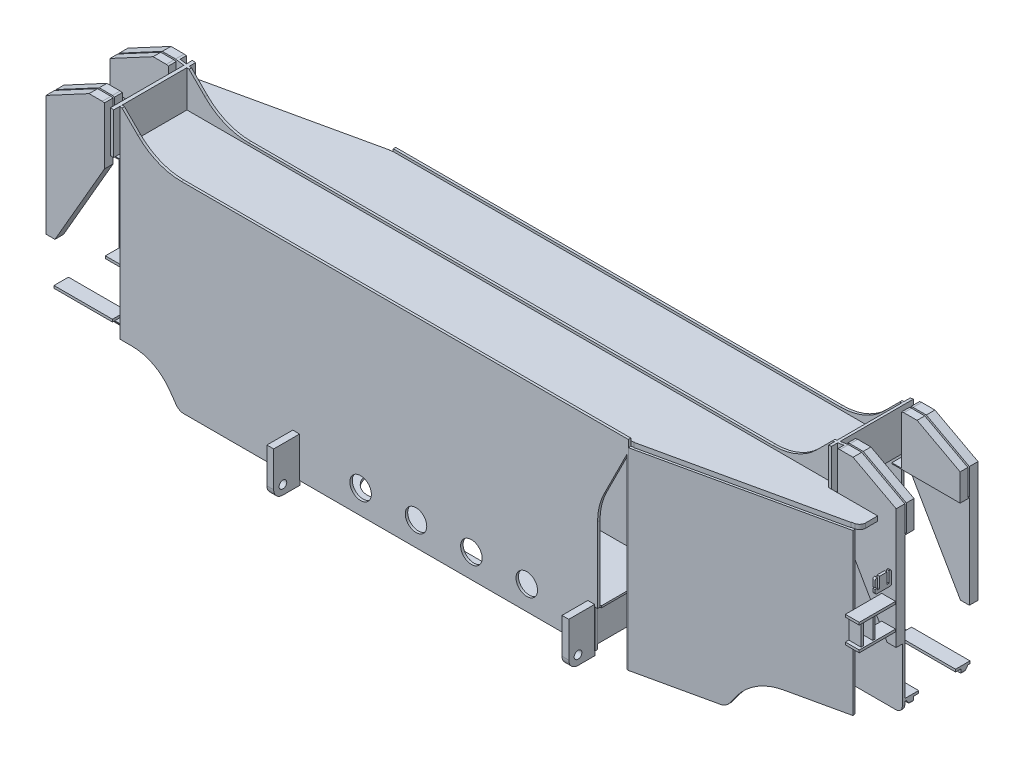
from build123d import *

# Parameters (mm, degrees)
EXTRUDE_1_DEPTH      = 8
SKETCH_4_R           = 35
SKETCH_4_R_2         = 20.25
SKETCH_4_R_3         = 10.5
CUT_EXTRUDE_2_DEPTH  = 8
EXTRUDE_2_DEPTH      = 8
SKETCH_8_R           = 35
CUT_EXTRUDE_4_DEPTH  = 8
EXTRUDE_3_DEPTH      = 8
SKETCH_12_R          = 35
CUT_EXTRUDE_6_DEPTH  = 8
EXTRUDE_4_DEPTH      = 626.98
EXTRUDE_5_DEPTH      = 626.98
EXTRUDE_6_DEPTH      = 56
EXTRUDE_7_DEPTH      = 56
EXTRUDE_8_DEPTH      = 15
EXTRUDE_9_DEPTH      = 15
SKETCH_23_W          = 1294.5
SKETCH_23_H          = 210
EXTRUDE_10_DEPTH     = 8
SKETCH_25_R          = 60
CUT_EXTRUDE_8_DEPTH  = 8
SKETCH_26_W          = 1294.5
SKETCH_26_H          = 210
EXTRUDE_11_DEPTH     = 8
SKETCH_27_R          = 60
CUT_EXTRUDE_9_DEPTH  = 8
SKETCH_29_W          = 944
SKETCH_29_H          = 210
EXTRUDE_12_DEPTH     = 6
SKETCH_30_W          = 944
SKETCH_30_H          = 210
EXTRUDE_13_DEPTH     = 6
EXTRUDE_14_DEPTH     = 20
EXTRUDE_15_DEPTH     = 20
EXTRUDE_16_DEPTH     = 20
EXTRUDE_17_DEPTH     = 20
EXTRUDE_18_DEPTH     = 8
EXTRUDE_19_DEPTH     = 8
EXTRUDE_20_DEPTH     = 25
EXTRUDE_21_DEPTH     = 25
EXTRUDE_22_DEPTH     = 25
EXTRUDE_23_DEPTH     = 25
SKETCH_50_W          = 190
SKETCH_50_H          = 3
EXTRUDE_24_DEPTH     = 30
SKETCH_51_W          = 222
SKETCH_51_H          = 3
EXTRUDE_25_DEPTH     = 32
SKETCH_53_W          = 222
SKETCH_53_H          = 3
EXTRUDE_26_DEPTH     = 32
SKETCH_54_W          = 190
SKETCH_54_H          = 3
EXTRUDE_27_DEPTH     = 30
EXTRUDE_28_DEPTH     = 346.3065
CUT_EXTRUDE_11_DEPTH = 12
EXTRUDE_29_DEPTH     = 346.3065
CUT_EXTRUDE_12_DEPTH = 12
SKETCH_62_W          = 190
SKETCH_62_H          = 47
SKETCH_62_W_2        = 617.292
EXTRUDE_30_DEPTH     = 8
SKETCH_63_W          = 617.292
SKETCH_63_H          = 47
SKETCH_63_W_2        = 190
EXTRUDE_31_DEPTH     = 8
EXTRUDE_32_DEPTH     = 319
EXTRUDE_33_DEPTH     = 319
EXTRUDE_34_DEPTH     = 319
EXTRUDE_35_DEPTH     = 319
SKETCH_71_W          = 2705
SKETCH_71_H          = 940
CUT_EXTRUDE_14_DEPTH = 600
SKETCH_73_W          = 214
SKETCH_73_H          = 109
EXTRUDE_36_DEPTH     = 22
SKETCH_75_R          = 12.5
CUT_EXTRUDE_16_DEPTH = 22
SKETCH_77_W          = 214
SKETCH_77_H          = 109
EXTRUDE_37_DEPTH     = 22
SKETCH_79_R          = 12.5
CUT_EXTRUDE_18_DEPTH = 22
SKETCH_81_W          = 118
SKETCH_81_H          = 8
EXTRUDE_38_DEPTH     = 45
SKETCH_83_W          = 8
SKETCH_83_H          = 70
EXTRUDE_39_DEPTH     = 40
SKETCH_85_W          = 118
SKETCH_85_H          = 8
EXTRUDE_40_DEPTH     = 45
SKETCH_86_W          = 8
SKETCH_86_H          = 70
EXTRUDE_41_DEPTH     = 40
EXTRUDE_42_DEPTH     = 8
SKETCH_90_W          = 7
SKETCH_90_H          = 42
CUT_EXTRUDE_20_DEPTH = 8
SKETCH_91_R          = 2.5
CUT_EXTRUDE_21_DEPTH = 8
EXTRUDE_43_DEPTH     = 8
SKETCH_95_W          = 7
SKETCH_95_H          = 42
CUT_EXTRUDE_23_DEPTH = 8
SKETCH_96_R          = 2.5
CUT_EXTRUDE_24_DEPTH = 8
EXTRUDE_44_DEPTH     = 266
EXTRUDE_45_DEPTH     = 266
EXTRUDE_46_DEPTH     = 188
EXTRUDE_47_DEPTH     = 188


with BuildPart() as part:
    # ｽｹｯﾁ2 → ﾎﾞｽ - 押し出し1 (new body)
    with BuildSketch(Plane.XY.offset(238)):
        with BuildLine():
            Line((20, 120), (259.781, 119.999840908))
            ThreePointArc((259.781, 119.999840908), (329.136433358, 103.002917773), (382.774130448, 55.864091069))
            Line((382.774130448, 55.864091069), (403.045155312, 26.827108426))
            ThreePointArc((403.045155312, 26.827108426), (413.772782228, 17.399235302), (427.644, 13.999810585))
            Line((427.644, 13.999810585), (2117.356, 13.999810585))
            ThreePointArc((2117.356, 13.999810585), (2131.227217772, 17.399235302), (2141.954844688, 26.827108426))
            Line((2141.954844688, 26.827108426), (2162.225869552, 55.864091069))
            ThreePointArc((2162.225869552, 55.864091069), (2215.863566642, 103.002917773), (2285.219, 119.999840908))
            Line((2285.219, 119.999840908), (2525, 120))
            ThreePointArc((2525, 120), (2539.142135624, 125.857864376), (2545, 140))
            Line((2545, 140), (2545, 315.36))
            Line((2545, 315.36), (2545, 706))
            Line((2545, 706), (2405, 781))
            Line((2405, 781), (2362, 781))
            Line((2362, 781), (2318, 774))
            Line((2318, 774), (2266.578928118, 722.579071882))
            ThreePointArc((2266.578928118, 722.579071882), (2201.694052016, 679.224134879), (2125.157, 663.999898344))
            Line((2125.157, 663.999898344), (419.843, 663.999898344))
            ThreePointArc((419.843, 663.999898344), (343.305947984, 679.224134879), (278.421071882, 722.579071882))
            Line((278.421071882, 722.579071882), (227, 774))
            Line((227, 774), (183, 781))
            Line((183, 781), (140, 781))
            Line((140, 781), (0, 706))
            Line((0, 706), (0, 315.36))
            Line((0, 315.36), (0, 140))
            ThreePointArc((0, 140), (5.857864376, 125.857864376), (20, 120))
        make_face()
    extrude(amount=EXTRUDE_1_DEPTH)

    # ｽｹｯﾁ4 → ｶｯﾄ - 押し出し2 (cut)
    with BuildSketch(Plane.XY.offset(238)):
        with Locations((972.5, 92)):
            Circle(SKETCH_4_R)
        with Locations((1272.5, 92)):
            Circle(SKETCH_4_R)
        with Locations((1572.5, 92)):
            Circle(SKETCH_4_R)
        with Locations((50, 499)):
            Circle(SKETCH_4_R_2)
        with Locations((2495, 499)):
            Circle(SKETCH_4_R_2)
        with Locations((27, 401.5)):
            Circle(SKETCH_4_R_3)
        with Locations((2518, 401.5)):
            Circle(SKETCH_4_R_3)
        with BuildLine():
            Line((1072.5, 297), (1472.5, 297))
            ThreePointArc((1472.5, 297), (1543.210678119, 326.289321881), (1572.5, 397))
            ThreePointArc((1572.5, 397), (1543.210678119, 467.710678119), (1472.5, 497))
            Line((1472.5, 497), (1072.5, 497))
            ThreePointArc((1072.5, 497), (1001.789321881, 467.710678119), (972.5, 397))
            ThreePointArc((972.5, 397), (1001.789321881, 326.289321881), (1072.5, 297))
        make_face()
    extrude(amount=CUT_EXTRUDE_2_DEPTH, mode=Mode.SUBTRACT)



with BuildPart() as body_2:
    # ｽｹｯﾁ6 → ﾎﾞｽ - 押し出し2 (new body)
    with BuildSketch(Plane.XY.offset(20)):
        with BuildLine():
            Line((781, 14), (2117.356, 13.999810585))
            ThreePointArc((2117.356, 13.999810585), (2131.227217772, 17.399235302), (2141.954844688, 26.827108426))
            Line((2141.954844688, 26.827108426), (2162.225869552, 55.864091069))
            ThreePointArc((2162.225869552, 55.864091069), (2215.863566642, 103.002917773), (2285.219, 119.999840908))
            Line((2285.219, 119.999840908), (2325, 120))
            Line((2325, 120), (2325, 775.113636364))
            Line((2325, 775.113636364), (2318, 774))
            Line((2318, 774), (2266.578928118, 722.579071882))
            ThreePointArc((2266.578928118, 722.579071882), (2201.694052016, 679.224134879), (2125.157, 663.999898344))
            Line((2125.157, 663.999898344), (672.5, 664))
            Line((672.5, 664), (672.5, 629))
            Line((672.5, 629), (751.3851191, 471.22905955))
            ThreePointArc((751.3851191, 471.22905955), (767.149616924, 427.736771141), (772.499866842, 381.786))
            Line((772.499866842, 381.786), (772.5, 138))
            Line((772.5, 138), (781, 138))
            Line((781, 138), (781, 14))
        make_face()
    extrude(amount=EXTRUDE_2_DEPTH)

    # ｽｹｯﾁ8 → ｶｯﾄ - 押し出し4 (cut)
    with BuildSketch(Plane.XY.offset(20)):
        with Locations((1002.5, 92)):
            Circle(SKETCH_8_R)
        with Locations((1182.5, 92)):
            Circle(SKETCH_8_R)
        with Locations((1362.5, 92)):
            Circle(SKETCH_8_R)
        with Locations((1542.5, 92)):
            Circle(SKETCH_8_R)
    extrude(amount=CUT_EXTRUDE_4_DEPTH, mode=Mode.SUBTRACT)

    # ｽｹｯﾁ14 → ﾎﾞｽ - 押し出し4 (add)
    with BuildSketch(Plane(origin=(0, 14, 0), x_dir=(1, 0, 0), z_dir=(0, 1, 0))):
        Polygon((678.359363657, -26.708544411), (75.7, -159.54), (73.978059215, -151.727515124), (671.628819639, -20), (676.880741117, -20), align=None)
    extrude(amount=EXTRUDE_4_DEPTH)

    # ｽｹｯﾁ17 → ﾎﾞｽ - 押し出し6 (add)
    with BuildSketch(Plane(origin=(0, 600, 0), x_dir=(1, 0, 0), z_dir=(0, 1, 0))):
        Polygon((662.519151307, -29.175865372), (85.250363496, -156.411013409), (85.680848693, -158.364134628), (662.949636504, -31.128986591), align=None)
    extrude(amount=EXTRUDE_6_DEPTH)


with BuildPart() as body_3:
    # ｽｹｯﾁ10 → ﾎﾞｽ - 押し出し3 (new body)
    with BuildSketch(Plane.XY.offset(456)):
        with BuildLine():
            Line((1764, 14), (1764, 138))
            Line((1764, 138), (1772.5, 138))
            Line((1772.5, 138), (1772.500133158, 381.786))
            ThreePointArc((1772.500133158, 381.786), (1777.850383076, 427.736771141), (1793.6148809, 471.22905955))
            Line((1793.6148809, 471.22905955), (1872.5, 629))
            Line((1872.5, 629), (1872.5, 664))
            Line((1872.5, 664), (419.843, 663.999898344))
            ThreePointArc((419.843, 663.999898344), (343.305947984, 679.224134879), (278.421071882, 722.579071882))
            Line((278.421071882, 722.579071882), (227, 774))
            Line((227, 774), (220, 775.113636364))
            Line((220, 775.113636364), (220, 120))
            Line((220, 120), (259.781, 119.999840908))
            ThreePointArc((259.781, 119.999840908), (329.136433358, 103.002917773), (382.774130448, 55.864091069))
            Line((382.774130448, 55.864091069), (403.045155312, 26.827108426))
            ThreePointArc((403.045155312, 26.827108426), (413.772782228, 17.399235302), (427.644, 13.999810585))
            Line((427.644, 13.999810585), (1764, 14))
        make_face()
    extrude(amount=EXTRUDE_3_DEPTH)

    # ｽｹｯﾁ12 → ｶｯﾄ - 押し出し6 (cut)
    with BuildSketch(Plane.XY.offset(456)):
        with Locations((1002.5, 92)):
            Circle(SKETCH_12_R)
        with Locations((1182.5, 92)):
            Circle(SKETCH_12_R)
        with Locations((1362.5, 92)):
            Circle(SKETCH_12_R)
        with Locations((1542.5, 92)):
            Circle(SKETCH_12_R)
    extrude(amount=CUT_EXTRUDE_6_DEPTH, mode=Mode.SUBTRACT)

    # ｽｹｯﾁ15 → ﾎﾞｽ - 押し出し5 (add)
    with BuildSketch(Plane(origin=(0, 14, 0), x_dir=(1, 0, 0), z_dir=(0, 1, 0))):
        Polygon((1866.640636343, -457.291455589), (2469.3, -324.46), (2471.021940785, -332.272484876), (1873.371180361, -464), (1868.119258883, -464), align=None)
    extrude(amount=EXTRUDE_5_DEPTH)

    # ｽｹｯﾁ18 → ﾎﾞｽ - 押し出し7 (add)
    with BuildSketch(Plane(origin=(0, 600, 0), x_dir=(1, 0, 0), z_dir=(0, 1, 0))):
        Polygon((1882.480848693, -454.824134628), (2459.749636504, -327.588986591), (2459.319151307, -325.635865372), (1882.050363496, -452.871013409), align=None)
    extrude(amount=EXTRUDE_7_DEPTH)


with BuildPart() as part_1:
    add(part.part)

    add(body_2.part)  # ﾎﾞｽ - 押し出し8 merges body 2
    # ｽｹｯﾁ20 → ﾎﾞｽ - 押し出し8 (add)
    with BuildSketch(Plane(origin=(0, 641, 0), x_dir=(1, 0, 0), z_dir=(0, 1, 0))):
        with BuildLine():
            Line((672.5, -28), (75.720556621, -159.532541471))
            ThreePointArc((75.720556621, -159.532541471), (64.416289327, -166.53198258), (59.997398288, -179.072))
            Line((59.997398288, -179.072), (60, -218))
            Line((60, -218), (220, -218))
            Line((220, -218), (220, -238))
            Line((220, -238), (2324.98, -238))
            Line((2324.98, -238), (2324.98, -28))
            Line((2324.98, -28), (672.5, -28))
        make_face()
    extrude(amount=EXTRUDE_8_DEPTH)


    add(body_3.part)  # ﾎﾞｽ - 押し出し9 merges body 3
    # ｽｹｯﾁ21 → ﾎﾞｽ - 押し出し9 (add)
    with BuildSketch(Plane(origin=(0, 641, 0), x_dir=(1, 0, 0), z_dir=(0, 1, 0))):
        with BuildLine():
            Line((1872.5, -456), (2469.279443379, -324.467458529))
            ThreePointArc((2469.279443379, -324.467458529), (2480.583710673, -317.46801742), (2485.002601712, -304.928))
            Line((2485.002601712, -304.928), (2485, -266))
            Line((2485, -266), (2325, -266))
            Line((2325, -266), (2325, -246))
            Line((2325, -246), (220.02, -246))
            Line((220.02, -246), (220.02, -456))
            Line((220.02, -456), (1872.5, -456))
        make_face()
    extrude(amount=EXTRUDE_9_DEPTH)

    # ｽｹｯﾁ23 → ﾎﾞｽ - 押し出し10 (add)
    with BuildSketch(Plane(origin=(0, 22, 0), x_dir=(1, 0, 0), z_dir=(0, 1, 0))):
        with Locations((1451.25, -133)):
            Rectangle(SKETCH_23_W, SKETCH_23_H)
    extrude(amount=EXTRUDE_10_DEPTH)

    # ｽｹｯﾁ25 → ｶｯﾄ - 押し出し8 (cut)
    with BuildSketch(Plane(origin=(0, 22, 0), x_dir=(1, 0, 0), z_dir=(0, 1, 0))):
        with Locations((972, -133)):
            Circle(SKETCH_25_R)
        with Locations((1572, -133)):
            Circle(SKETCH_25_R)
        with Locations((1942, -133)):
            Circle(SKETCH_25_R)
        with BuildLine():
            Line((1202, -73), (1342, -73))
            ThreePointArc((1342, -73), (1384.426406871, -90.573593129), (1402, -133))
            ThreePointArc((1402, -133), (1384.426406871, -175.426406871), (1342, -193))
            Line((1342, -193), (1202, -193))
            ThreePointArc((1202, -193), (1159.573593129, -175.426406871), (1142, -133))
            ThreePointArc((1142, -133), (1159.573593129, -90.573593129), (1202, -73))
        make_face()
    extrude(amount=CUT_EXTRUDE_8_DEPTH, mode=Mode.SUBTRACT)

    # ｽｹｯﾁ26 → ﾎﾞｽ - 押し出し11 (add)
    with BuildSketch(Plane(origin=(0, 22, 0), x_dir=(1, 0, 0), z_dir=(0, 1, 0))):
        with Locations((1093.75, -351)):
            Rectangle(SKETCH_26_W, SKETCH_26_H)
    extrude(amount=EXTRUDE_11_DEPTH)

    # ｽｹｯﾁ27 → ｶｯﾄ - 押し出し9 (cut)
    with BuildSketch(Plane(origin=(0, 22, 0), x_dir=(1, 0, 0), z_dir=(0, 1, 0))):
        with Locations((603, -351)):
            Circle(SKETCH_27_R)
        with Locations((973, -351)):
            Circle(SKETCH_27_R)
        with Locations((1573, -351)):
            Circle(SKETCH_27_R)
        with BuildLine():
            Line((1203, -291), (1343, -291))
            ThreePointArc((1343, -291), (1385.426406871, -308.573593129), (1403, -351))
            ThreePointArc((1403, -351), (1385.426406871, -393.426406871), (1343, -411))
            Line((1343, -411), (1203, -411))
            ThreePointArc((1203, -411), (1160.573593129, -393.426406871), (1143, -351))
            ThreePointArc((1143, -351), (1160.573593129, -308.573593129), (1203, -291))
        make_face()
    extrude(amount=CUT_EXTRUDE_9_DEPTH, mode=Mode.SUBTRACT)

    # ｽｹｯﾁ29 → ﾎﾞｽ - 押し出し12 (add)
    with BuildSketch(Plane(origin=(0, 138, 0), x_dir=(1, 0, 0), z_dir=(0, 1, 0))):
        with Locations((1240, -133)):
            Rectangle(SKETCH_29_W, SKETCH_29_H)
    extrude(amount=EXTRUDE_12_DEPTH)

    # ｽｹｯﾁ30 → ﾎﾞｽ - 押し出し13 (add)
    with BuildSketch(Plane(origin=(0, 138, 0), x_dir=(1, 0, 0), z_dir=(0, 1, 0))):
        with Locations((1305, -351)):
            Rectangle(SKETCH_30_W, SKETCH_30_H)
    extrude(amount=EXTRUDE_13_DEPTH)

    # ｽｹｯﾁ32 → ﾎﾞｽ - 押し出し14 (add)
    with BuildSketch(Plane.XY.offset(218)):
        Polygon((0, 315.36), (29.105181683, 315.36), (190, 594.038), (190, 779.886363636), (183, 781), (140, 781), (0, 706), align=None)
    extrude(amount=EXTRUDE_14_DEPTH)

    # ｽｹｯﾁ37 → ﾎﾞｽ - 押し出し17 (add)
    with BuildSketch(Plane.XY.offset(246)):
        Polygon((2545, 315.36), (2545, 706), (2405, 781), (2362, 781), (2355, 779.886363636), (2355, 594.038), (2515.894818317, 315.36), align=None)
    extrude(amount=EXTRUDE_17_DEPTH)



with BuildPart() as body_2_2:
    # ｽｹｯﾁ34 → ﾎﾞｽ - 押し出し15 (new body)
    with BuildSketch(Plane.XY.offset(464)):
        Polygon((0, 315.36), (29.105181683, 315.36), (190, 594.038), (190, 779.886363636), (183, 781), (140, 781), (0, 706), align=None)
    extrude(amount=EXTRUDE_15_DEPTH)

    # ｽｹｯﾁ41 → ﾎﾞｽ - 押し出し19 (add)
    with BuildSketch(Plane.XY.offset(456)):
        Polygon((0, 315.36), (29.105181683, 315.36), (190, 594.038), (190, 779.886363636), (183, 781), (140, 781), (0, 706), align=None)
    extrude(amount=EXTRUDE_19_DEPTH)


with BuildPart() as body_3_2:
    # ｽｹｯﾁ35 → ﾎﾞｽ - 押し出し16 (new body)
    with BuildSketch(Plane.XY):
        Polygon((2545, 315.36), (2545, 706), (2405, 781), (2362, 781), (2355, 779.886363636), (2355, 594.038), (2515.894818317, 315.36), align=None)
    extrude(amount=EXTRUDE_16_DEPTH)

    # ｽｹｯﾁ39 → ﾎﾞｽ - 押し出し18 (add)
    with BuildSketch(Plane.XY.offset(20)):
        Polygon((2545, 315.36), (2545, 706), (2405, 781), (2362, 781), (2355, 779.886363636), (2355, 594.038), (2515.894818317, 315.36), align=None)
    extrude(amount=EXTRUDE_18_DEPTH)


with BuildPart() as body_4:
    # ｽｹｯﾁ43 → ﾎﾞｽ - 押し出し20 (new body)
    with BuildSketch(Plane.XY.offset(251)):
        Polygon((0, 620.82), (190, 620.82), (190, 779.886363636), (183, 781), (140, 781), (0, 706), align=None)
    extrude(amount=EXTRUDE_20_DEPTH)


with BuildPart() as body_5:
    # ｽｹｯﾁ45 → ﾎﾞｽ - 押し出し21 (new body)
    with BuildSketch(Plane.XY.offset(426)):
        Polygon((0, 620.82), (190, 620.82), (190, 779.886363636), (183, 781), (140, 781), (0, 706), align=None)
    extrude(amount=EXTRUDE_21_DEPTH)


with BuildPart() as body_6:
    # ｽｹｯﾁ47 → ﾎﾞｽ - 押し出し22 (new body)
    with BuildSketch(Plane.XY.offset(33)):
        Polygon((2545, 620.82), (2545, 706), (2405, 781), (2362, 781), (2355, 779.886363636), (2355, 620.82), align=None)
    extrude(amount=EXTRUDE_22_DEPTH)


with BuildPart() as body_7:
    # ｽｹｯﾁ49 → ﾎﾞｽ - 押し出し23 (new body)
    with BuildSketch(Plane.XY.offset(208)):
        Polygon((2545, 620.82), (2545, 706), (2405, 781), (2362, 781), (2355, 779.886363636), (2355, 620.82), align=None)
    extrude(amount=EXTRUDE_23_DEPTH)


with BuildPart() as part_2:
    add(part_1.part)

    add(body_4.part)  # ﾎﾞｽ - 押し出し24 merges body 4
    # ｽｹｯﾁ50 → ﾎﾞｽ - 押し出し24 (add)
    with BuildSketch(Plane.XY.offset(246)):
        with Locations((95, 619.32)):
            Rectangle(SKETCH_50_W, SKETCH_50_H)
    extrude(amount=EXTRUDE_24_DEPTH)


    add(body_2_2.part)  # ﾎﾞｽ - 押し出し25 merges body 2 2

    add(body_5.part)  # ﾎﾞｽ - 押し出し25 merges body 5
    # ｽｹｯﾁ51 → ﾎﾞｽ - 押し出し25 (add)
    with BuildSketch(Plane.XY.offset(426)):
        with Locations((111, 619.32)):
            Rectangle(SKETCH_51_W, SKETCH_51_H)
    extrude(amount=EXTRUDE_25_DEPTH)


    add(body_3_2.part)  # ﾎﾞｽ - 押し出し26 merges body 3 2

    add(body_6.part)  # ﾎﾞｽ - 押し出し26 merges body 6
    # ｽｹｯﾁ53 → ﾎﾞｽ - 押し出し26 (add)
    with BuildSketch(Plane.XY.offset(26)):
        with Locations((2434, 619.32)):
            Rectangle(SKETCH_53_W, SKETCH_53_H)
    extrude(amount=EXTRUDE_26_DEPTH)


    add(body_7.part)  # ﾎﾞｽ - 押し出し27 merges body 7
    # ｽｹｯﾁ54 → ﾎﾞｽ - 押し出し27 (add)
    with BuildSketch(Plane.XY.offset(208)):
        with Locations((2450, 619.32)):
            Rectangle(SKETCH_54_W, SKETCH_54_H)
    extrude(amount=EXTRUDE_27_DEPTH)



with BuildPart() as body_2_3:
    # ｽｹｯﾁ55 → ﾎﾞｽ - 押し出し28 (new body)
    with BuildSketch(Plane(origin=(0, 0, 0), x_dir=(0, 0, -1), z_dir=(1, 0, 0))):
        Polygon((-251.6, 150), (-450.4, 150), (-450.4, 149), (-442.698, 138), (-259.302, 138), (-251.6, 149), align=None)
    extrude(amount=EXTRUDE_28_DEPTH)

    # ｽｹｯﾁ57 → ｶｯﾄ - 押し出し11 (cut)
    with BuildSketch(Plane(origin=(0, 138, 0), x_dir=(1, 0, 0), z_dir=(0, 1, 0))):
        with BuildLine():
            Line((-10, -273.771), (155, -273.771))
            ThreePointArc((155, -273.771), (183.284271247, -285.486728753), (195, -313.771))
            Line((195, -313.771), (195, -388.229))
            ThreePointArc((195, -388.229), (183.284271247, -416.513271247), (155, -428.229))
            Line((155, -428.229), (-10, -428.229))
            Line((-10, -428.229), (-10, -273.771))
        make_face()
    extrude(amount=CUT_EXTRUDE_11_DEPTH, mode=Mode.SUBTRACT)


with BuildPart() as body_3_3:
    # ｽｹｯﾁ59 → ﾎﾞｽ - 押し出し29 (new body)
    with BuildSketch(Plane(origin=(2545, 0, 0), x_dir=(0, 0, -1), z_dir=(1, 0, 0))):
        Polygon((-232.4, 150), (-232.4, 149), (-224.698, 138), (-41.302, 138), (-33.6, 149), (-33.6, 150), align=None)
    extrude(amount=-EXTRUDE_29_DEPTH)

    # ｽｹｯﾁ60 → ｶｯﾄ - 押し出し12 (cut)
    with BuildSketch(Plane(origin=(0, 138, 0), x_dir=(1, 0, 0), z_dir=(0, 1, 0))):
        with BuildLine():
            Line((2555, -210.229), (2390, -210.229))
            ThreePointArc((2390, -210.229), (2361.715728753, -198.513271247), (2350, -170.229))
            Line((2350, -170.229), (2350, -95.771))
            ThreePointArc((2350, -95.771), (2361.715728753, -67.486728753), (2390, -55.771))
            Line((2390, -55.771), (2555, -55.771))
            Line((2555, -55.771), (2555, -210.229))
        make_face()
    extrude(amount=CUT_EXTRUDE_12_DEPTH, mode=Mode.SUBTRACT)


with BuildPart() as part_3:
    add(part_2.part)

    add(body_2_3.part)  # ﾎﾞｽ - 押し出し30 merges body 2 3
    # ｽｹｯﾁ62 → ﾎﾞｽ - 押し出し30 (add)
    with BuildSketch(Plane(origin=(0, 150, 0), x_dir=(1, 0, 0), z_dir=(0, 1, 0))):
        with Locations((95, -267.5)):
            Rectangle(SKETCH_62_W, SKETCH_62_H)
        with Locations((95, -434.5)):
            Rectangle(SKETCH_62_W, SKETCH_62_H)
        with Locations((524.354, -267.5)):
            Rectangle(SKETCH_62_W_2, SKETCH_62_H)
        with Locations((524.354, -434.5)):
            Rectangle(SKETCH_62_W_2, SKETCH_62_H)
    extrude(amount=EXTRUDE_30_DEPTH)


    add(body_3_3.part)  # ﾎﾞｽ - 押し出し31 merges body 3 3
    # ｽｹｯﾁ63 → ﾎﾞｽ - 押し出し31 (add)
    with BuildSketch(Plane(origin=(0, 150, 0), x_dir=(1, 0, 0), z_dir=(0, 1, 0))):
        with Locations((2020.646, -216.5)):
            Rectangle(SKETCH_63_W, SKETCH_63_H)
        with Locations((2020.646, -49.5)):
            Rectangle(SKETCH_63_W, SKETCH_63_H)
        with Locations((2450, -216.5)):
            Rectangle(SKETCH_63_W_2, SKETCH_63_H)
        with Locations((2450, -49.5)):
            Rectangle(SKETCH_63_W_2, SKETCH_63_H)
    extrude(amount=EXTRUDE_31_DEPTH)

    # ｽｹｯﾁ65 → ﾎﾞｽ - 押し出し32 (add)
    with BuildSketch(Plane(origin=(1771.5, 0, 0), x_dir=(0, 0, -1), z_dir=(1, 0, 0))):
        Polygon((-28, 30), (-40.32, 29.97), (-63.75, 129.12), (-53.54, 138), align=None)
    extrude(amount=EXTRUDE_32_DEPTH)

    # ｽｹｯﾁ66 → ﾎﾞｽ - 押し出し33 (add)
    with BuildSketch(Plane(origin=(1771.5, 0, 0), x_dir=(0, 0, -1), z_dir=(1, 0, 0))):
        Polygon((-212.46, 138), (-202.25, 129.12), (-225.68, 29.97), (-238, 30), align=None)
    extrude(amount=EXTRUDE_33_DEPTH)

    # ｽｹｯﾁ68 → ﾎﾞｽ - 押し出し34 (add)
    with BuildSketch(Plane(origin=(454.5, 0, 0), x_dir=(0, 0, -1), z_dir=(1, 0, 0))):
        Polygon((-430.46, 138), (-420.25, 129.12), (-443.68, 29.97), (-456, 30), align=None)
    extrude(amount=EXTRUDE_34_DEPTH)

    # ｽｹｯﾁ69 → ﾎﾞｽ - 押し出し35 (add)
    with BuildSketch(Plane(origin=(454.5, 0, 0), x_dir=(0, 0, -1), z_dir=(1, 0, 0))):
        Polygon((-246, 30), (-258.32, 29.97), (-281.75, 129.12), (-271.54, 138), align=None)
    extrude(amount=EXTRUDE_35_DEPTH)

    # ｽｹｯﾁ71 → ｶｯﾄ - 押し出し14 (cut)
    with BuildSketch(Plane.XY):
        with Locations((1272.5, 390)):
            Rectangle(SKETCH_71_W, SKETCH_71_H)
        with BuildLine():
            Line((20, 120), (259.781, 119.999840908))
            ThreePointArc((259.781, 119.999840908), (329.136433358, 103.002917773), (382.774130448, 55.864091069))
            Line((382.774130448, 55.864091069), (403.045155312, 26.827108426))
            ThreePointArc((403.045155312, 26.827108426), (413.772782228, 17.399235302), (427.644, 13.999810585))
            Line((427.644, 13.999810585), (2117.356, 13.999810585))
            ThreePointArc((2117.356, 13.999810585), (2131.227217772, 17.399235302), (2141.954844688, 26.827108426))
            Line((2141.954844688, 26.827108426), (2162.225869552, 55.864091069))
            ThreePointArc((2162.225869552, 55.864091069), (2215.863566642, 103.002917773), (2285.219, 119.999840908))
            Line((2285.219, 119.999840908), (2525, 120))
            ThreePointArc((2525, 120), (2539.142135624, 125.857864376), (2545, 140))
            Line((2545, 140), (2545, 315.36))
            Line((2545, 315.36), (2545, 706))
            Line((2545, 706), (2405, 781))
            Line((2405, 781), (2362, 781))
            Line((2362, 781), (2318, 774))
            Line((2318, 774), (2266.578928118, 722.579071882))
            ThreePointArc((2266.578928118, 722.579071882), (2201.694052016, 679.224134879), (2125.157, 663.999898344))
            Line((2125.157, 663.999898344), (419.843, 663.999898344))
            ThreePointArc((419.843, 663.999898344), (343.305947984, 679.224134879), (278.421071882, 722.579071882))
            Line((278.421071882, 722.579071882), (227, 774))
            Line((227, 774), (183, 781))
            Line((183, 781), (140, 781))
            Line((140, 781), (0, 706))
            Line((0, 706), (0, 315.36))
            Line((0, 315.36), (0, 140))
            ThreePointArc((0, 140), (5.857864376, 125.857864376), (20, 120))
        make_face(mode=Mode.SUBTRACT)
    extrude(amount=CUT_EXTRUDE_14_DEPTH, mode=Mode.SUBTRACT)

    # ｽｹｯﾁ73 → ﾎﾞｽ - 押し出し36 (add)
    with BuildSketch(Plane(origin=(782, 0, 0), x_dir=(0, 0, -1), z_dir=(1, 0, 0))):
        with Locations((-133, 83.5)):
            Rectangle(SKETCH_73_W, SKETCH_73_H)
        with Locations((-351, 83.5)):
            Rectangle(SKETCH_73_W, SKETCH_73_H)
        with BuildLine():
            Line((-462, 0), (-518, 0))
            ThreePointArc((-518, 0), (-539.213203436, 8.786796564), (-548, 30))
            Line((-548, 30), (-548, 145))
            Line((-548, 145), (-462, 145))
            Line((-462, 145), (-462, 0))
        make_face()
    extrude(amount=EXTRUDE_36_DEPTH)

    # ｽｹｯﾁ75 → ｶｯﾄ - 押し出し16 (cut)
    with BuildSketch(Plane(origin=(782, 0, 0), x_dir=(0, 0, -1), z_dir=(1, 0, 0))):
        with Locations((-518, 30)):
            Circle(SKETCH_75_R)
    extrude(amount=CUT_EXTRUDE_16_DEPTH, mode=Mode.SUBTRACT)

    # ｽｹｯﾁ77 → ﾎﾞｽ - 押し出し37 (add)
    with BuildSketch(Plane(origin=(1741, 0, 0), x_dir=(0, 0, -1), z_dir=(1, 0, 0))):
        with Locations((-133, 83.5)):
            Rectangle(SKETCH_77_W, SKETCH_77_H)
        with Locations((-351, 83.5)):
            Rectangle(SKETCH_77_W, SKETCH_77_H)
        with BuildLine():
            Line((-462, 0), (-518, 0))
            ThreePointArc((-518, 0), (-539.213203436, 8.786796564), (-548, 30))
            Line((-548, 30), (-548, 145))
            Line((-548, 145), (-462, 145))
            Line((-462, 145), (-462, 0))
        make_face()
    extrude(amount=EXTRUDE_37_DEPTH)

    # ｽｹｯﾁ79 → ｶｯﾄ - 押し出し18 (cut)
    with BuildSketch(Plane(origin=(1741, 0, 0), x_dir=(0, 0, -1), z_dir=(1, 0, 0))):
        with Locations((-518, 30)):
            Circle(SKETCH_79_R)
    extrude(amount=CUT_EXTRUDE_18_DEPTH, mode=Mode.SUBTRACT)

    # ｽｹｯﾁ81 → ﾎﾞｽ - 押し出し38 (add)
    with BuildSketch(Plane(origin=(2, 0, 0), x_dir=(0, 0, -1), z_dir=(1, 0, 0))):
        with Locations((-159, 362.5)):
            Rectangle(SKETCH_81_W, SKETCH_81_H)
        with Locations((-159, 440.5)):
            Rectangle(SKETCH_81_W, SKETCH_81_H)
    extrude(amount=EXTRUDE_38_DEPTH)

    # ｽｹｯﾁ83 → ﾎﾞｽ - 押し出し39 (add)
    with BuildSketch(Plane(origin=(7, 0, 0), x_dir=(0, 0, -1), z_dir=(1, 0, 0))):
        with Locations((-115, 401.5)):
            Rectangle(SKETCH_83_W, SKETCH_83_H)
        with Locations((-153, 401.5)):
            Rectangle(SKETCH_83_W, SKETCH_83_H)
    extrude(amount=EXTRUDE_39_DEPTH)

    # ｽｹｯﾁ85 → ﾎﾞｽ - 押し出し40 (add)
    with BuildSketch(Plane(origin=(2498, 0, 0), x_dir=(0, 0, -1), z_dir=(1, 0, 0))):
        with Locations((-325, 362.5)):
            Rectangle(SKETCH_85_W, SKETCH_85_H)
        with Locations((-325, 440.5)):
            Rectangle(SKETCH_85_W, SKETCH_85_H)
    extrude(amount=EXTRUDE_40_DEPTH)

    # ｽｹｯﾁ86 → ﾎﾞｽ - 押し出し41 (add)
    with BuildSketch(Plane(origin=(2498, 0, 0), x_dir=(0, 0, -1), z_dir=(1, 0, 0))):
        with Locations((-369, 401.5)):
            Rectangle(SKETCH_86_W, SKETCH_86_H)
        with Locations((-331, 401.5)):
            Rectangle(SKETCH_86_W, SKETCH_86_H)
    extrude(amount=EXTRUDE_41_DEPTH)

    # ｽｹｯﾁ88 → ﾎﾞｽ - 押し出し42 (add)
    with BuildSketch(Plane(origin=(15, 0, 0), x_dir=(0, 0, -1), z_dir=(1, 0, 0))):
        with BuildLine():
            Line((-170, 483), (-213, 483))
            ThreePointArc((-213, 483), (-216.535533906, 484.464466094), (-218, 488))
            Line((-218, 488), (-218, 523))
            ThreePointArc((-218, 523), (-216.535533906, 526.535533906), (-213, 528))
            Line((-213, 528), (-170, 528))
            ThreePointArc((-170, 528), (-166.464466094, 526.535533906), (-165, 523))
            Line((-165, 523), (-165, 488))
            ThreePointArc((-165, 488), (-166.464466094, 484.464466094), (-170, 483))
        make_face()
    extrude(amount=EXTRUDE_42_DEPTH)

    # ｽｹｯﾁ90 → ｶｯﾄ - 押し出し20 (cut)
    with BuildSketch(Plane(origin=(15, 0, 0), x_dir=(0, 0, -1), z_dir=(1, 0, 0))):
        with Locations((-175.5, 514)):
            Rectangle(SKETCH_90_W, SKETCH_90_H)
        with Locations((-206.5, 514)):
            Rectangle(SKETCH_90_W, SKETCH_90_H)
    extrude(amount=CUT_EXTRUDE_20_DEPTH, mode=Mode.SUBTRACT)

    # ｽｹｯﾁ91 → ｶｯﾄ - 押し出し21 (cut)
    with BuildSketch(Plane(origin=(15, 0, 0), x_dir=(0, 0, -1), z_dir=(1, 0, 0))):
        with Locations((-166, 500)):
            Circle(SKETCH_91_R)
    extrude(amount=CUT_EXTRUDE_21_DEPTH, mode=Mode.SUBTRACT)

    # ｽｹｯﾁ93 → ﾎﾞｽ - 押し出し43 (add)
    with BuildSketch(Plane(origin=(2522, 0, 0), x_dir=(0, 0, -1), z_dir=(1, 0, 0))):
        with BuildLine():
            Line((-271, 483), (-314, 483))
            ThreePointArc((-314, 483), (-317.535533906, 484.464466094), (-319, 488))
            Line((-319, 488), (-319, 523))
            ThreePointArc((-319, 523), (-317.535533906, 526.535533906), (-314, 528))
            Line((-314, 528), (-271, 528))
            ThreePointArc((-271, 528), (-267.464466094, 526.535533906), (-266, 523))
            Line((-266, 523), (-266, 488))
            ThreePointArc((-266, 488), (-267.464466094, 484.464466094), (-271, 483))
        make_face()
    extrude(amount=EXTRUDE_43_DEPTH)

    # ｽｹｯﾁ95 → ｶｯﾄ - 押し出し23 (cut)
    with BuildSketch(Plane(origin=(2522, 0, 0), x_dir=(0, 0, -1), z_dir=(1, 0, 0))):
        with Locations((-308.5, 514)):
            Rectangle(SKETCH_95_W, SKETCH_95_H)
        with Locations((-277.5, 514)):
            Rectangle(SKETCH_95_W, SKETCH_95_H)
    extrude(amount=CUT_EXTRUDE_23_DEPTH, mode=Mode.SUBTRACT)

    # ｽｹｯﾁ96 → ｶｯﾄ - 押し出し24 (cut)
    with BuildSketch(Plane(origin=(2522, 0, 0), x_dir=(0, 0, -1), z_dir=(1, 0, 0))):
        with Locations((-318, 500)):
            Circle(SKETCH_96_R)
    extrude(amount=CUT_EXTRUDE_24_DEPTH, mode=Mode.SUBTRACT)

    # ｽｹｯﾁ97 → ﾎﾞｽ - 押し出し44 (add)
    with BuildSketch(Plane.XY.offset(218)):
        Polygon((210, 641), (219.98, 641), (219.98, 775.116818182), (210, 776.704545455), align=None)
    extrude(amount=EXTRUDE_44_DEPTH)

    # ｽｹｯﾁ98 → ﾎﾞｽ - 押し出し45 (add)
    with BuildSketch(Plane.XY):
        Polygon((2325.02, 641), (2335, 641), (2335, 776.704545455), (2325.02, 775.116818182), align=None)
    extrude(amount=EXTRUDE_45_DEPTH)

    # ｽｹｯﾁ100 → ﾎﾞｽ - 押し出し46 (add)
    with BuildSketch(Plane.XY.offset(257)):
        Polygon((412.153071341, 22.088564795), (421.982928659, 28.971435205), (344.940879281, 139), (330.291633079, 139), align=None)
    extrude(amount=EXTRUDE_46_DEPTH)

    # ｽｹｯﾁ102 → ｶｯﾄ - 回転1 (revolve, cut)
    with BuildSketch(Plane.XY.offset(351)):
        Polygon((359.909130586, 63.575686645), (400.866869414, 92.254313355), (377.923968046, 125.020504419), (336.966229217, 96.341877708), align=None)
    revolve(axis=Axis((359.909130586, 63.575686645, 351), (0.8191547765792332, 0.573572534216403, 0)), mode=Mode.SUBTRACT)

    # ｽｹｯﾁ104 → ﾎﾞｽ - 押し出し47 (add)
    with BuildSketch(Plane.XY.offset(39)):
        Polygon((2214.708366921, 139), (2200.059120719, 139), (2123.017071341, 28.971435205), (2132.846928659, 22.088564795), align=None)
    extrude(amount=EXTRUDE_47_DEPTH)

    # ｽｹｯﾁ106 → ｶｯﾄ - 回転2 (revolve, cut)
    with BuildSketch(Plane.XY.offset(133)):
        Polygon((2185.090869414, 63.575686645), (2144.133130586, 92.254313355), (2121.190229217, 59.488122292), (2162.147968046, 30.809495581), align=None)
    revolve(axis=Axis((2185.090869414, 63.575686645, 133), (-0.8191547765792335, 0.5735725342164025, 0)), mode=Mode.SUBTRACT)


solid = part_3.part
